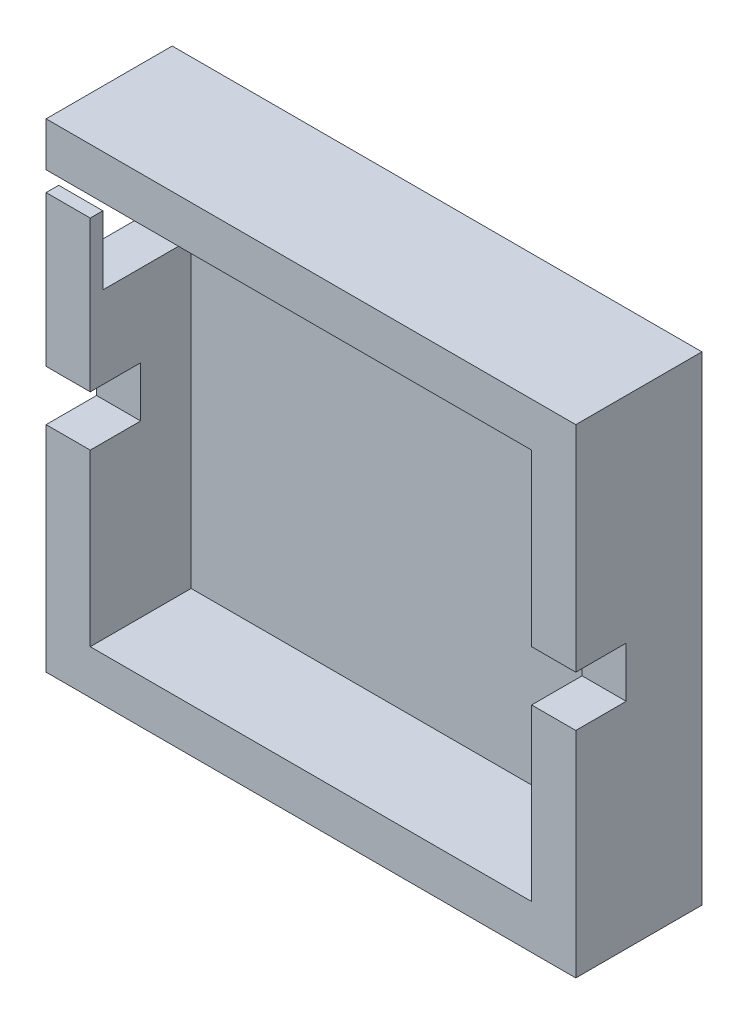
from build123d import *

# Parameters (mm, degrees)
SKETCH_1_W          = 42
SKETCH_1_H          = 38
EXTRUDE_1_DEPTH     = 2
SKETCH_2_W          = 42
SKETCH_2_H          = 38
SKETCH_2_W_2        = 35
SKETCH_2_H_2        = 31
EXTRUDE_2_DEPTH     = 8
CUT_EXTRUDE_1_DEPTH = 6.5
SKETCH_6_W          = 3.5
SKETCH_6_H          = 4
CUT_EXTRUDE_3_DEPTH = 4
SKETCH_7_W          = 23
SKETCH_7_H          = 4.2
CUT_EXTRUDE_4_DEPTH = 10


with BuildPart() as part:
    # 草图1 → 凸台-拉伸1 (new body)
    with BuildSketch(Plane.XY):
        with Locations((17.5, 15.5)):
            Rectangle(SKETCH_1_W, SKETCH_1_H)
    extrude(amount=EXTRUDE_1_DEPTH)

    # 草图2 → 凸台-拉伸2 (add)
    with BuildSketch(Plane.XY.offset(2)):
        with Locations((17.5, 15.5)):
            Rectangle(SKETCH_2_W, SKETCH_2_H)
        with Locations((17.5, 15.5)):
            Rectangle(SKETCH_2_W_2, SKETCH_2_H_2, mode=Mode.SUBTRACT)
    extrude(amount=EXTRUDE_2_DEPTH)

    # 草图3 → 切除-拉伸1 (cut)
    with BuildSketch(Plane.ZY.offset(3.5)):
        Polygon((2, 31), (2, 24), (9, 24), (9, 29.435420562), (10, 29.435420562), (10, 31), align=None)
    extrude(amount=-CUT_EXTRUDE_1_DEPTH, mode=Mode.SUBTRACT)

    # 草图6 → 切除-拉伸3 (cut)
    with BuildSketch(Plane.XY.offset(10)):
        with Locations((36.75, 15.5)):
            Rectangle(SKETCH_6_W, SKETCH_6_H)
        with Locations((-1.75, 15.5)):
            Rectangle(SKETCH_6_W, SKETCH_6_H)
    extrude(amount=-CUT_EXTRUDE_3_DEPTH, mode=Mode.SUBTRACT)

    # 草图7 → 切除-拉伸4 (cut)
    with BuildSketch(Plane(origin=(0, 0, 0), x_dir=(-1, 0, 0), z_dir=(0, 0, -1))):
        with Locations((-16.5, 26)):
            Rectangle(SKETCH_7_W, SKETCH_7_H)
    extrude(amount=-CUT_EXTRUDE_4_DEPTH, mode=Mode.SUBTRACT)


solid = part.part
